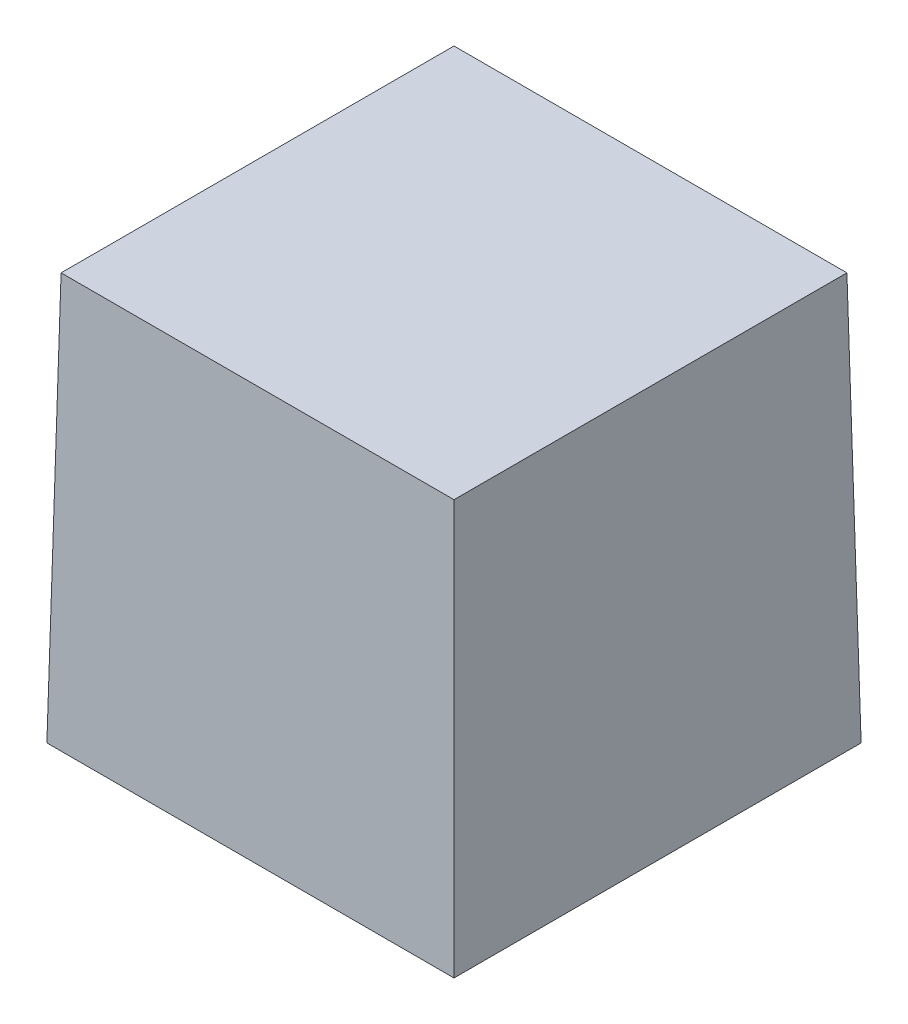
from build123d import *

# Parameters (mm, degrees)
ESBO_O1_W                = 30
ESBO_O1_H                = 30
RESSALTO_EXTRUS_O1_DEPTH = 30
RESSALTO_EXTRUS_O1_TAPER = 1


with BuildPart() as part:
    # Esboço1 → Ressalto-extrusão1 (new body)
    with BuildSketch(Plane(origin=(0, 0, 0), x_dir=(1, 0, 0), z_dir=(0, 1, 0))):
        with Locations((15, 15)):
            Rectangle(ESBO_O1_W, ESBO_O1_H)
    extrude(amount=RESSALTO_EXTRUS_O1_DEPTH, taper=RESSALTO_EXTRUS_O1_TAPER)


solid = part.part
